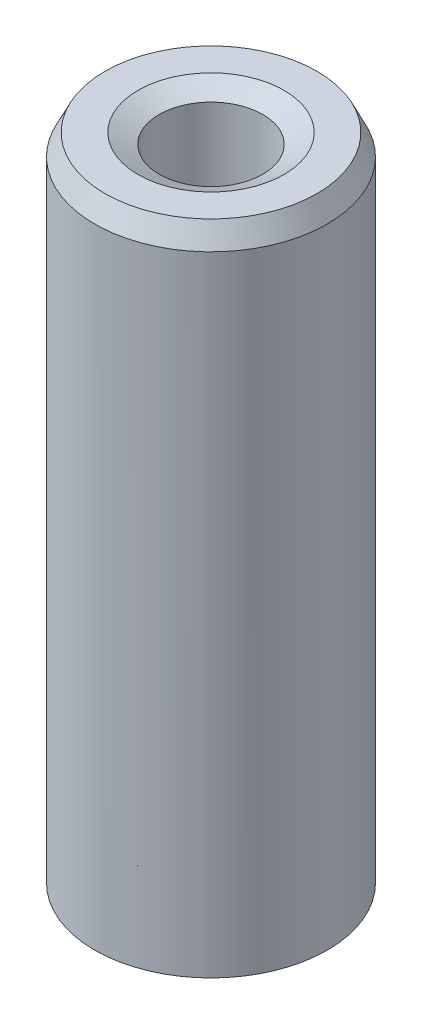
from build123d import *
from OCP.BRepFilletAPI import BRepFilletAPI_MakeChamfer

# Parameters (mm, degrees)
SKETCH1_R           = 5
BOSS_EXTRUDE1_DEPTH = 28.382326129
SKETCH2_R           = 2.226436313
CUT_EXTRUDE1_DEPTH  = 30.24989635
CHAMFER1_SIZE       = 0.910586834
CHAMFER1_SIZE2      = 0.444401364


with BuildPart() as part:
    # Sketch1 → Boss-Extrude1 (new body)
    with BuildSketch(Plane(origin=(0, 0, 0), x_dir=(1, 0, 0), z_dir=(0, 1, 0))):
        Circle(SKETCH1_R)
    extrude(amount=BOSS_EXTRUDE1_DEPTH)

    # Sketch2 → Cut-Extrude1 (cut, through all)
    with BuildSketch(Plane(origin=(0, 0, 0), x_dir=(1, 0, 0), z_dir=(0, 1, 0))):
        Circle(SKETCH2_R)
    extrude(amount=CUT_EXTRUDE1_DEPTH, mode=Mode.SUBTRACT)

    # Chamfer1: one chamfer whose edges measure the first distance from different faces: ONE call of the kernel's chamfer builder (chamfer() names one face for all edges)
    chamfer1_edges_1 = [part.edges().sort_by_distance(p)[0] for p in [
        (-2.226436313, 28.382326129, 0),
    ]]
    chamfer1_side_1 = [part.faces().sort_by_distance(p)[0] for p in [
        (-4.858578644, 28.382326129, 0),
    ]]
    chamfer1_edges_2 = [part.edges().sort_by_distance(p)[0] for p in [
        (-2.226436313, 0, 0),
    ]]
    chamfer1_side_2 = [part.faces().sort_by_distance(p)[0] for p in [
        (-2.226436313, 14.191163065, 0),
    ]]
    chamfer1_edges_3 = [part.edges().sort_by_distance(p)[0] for p in [
        (-5, 0, 0),
    ]]
    chamfer1_side_3 = [part.faces().sort_by_distance(p)[0] for p in [
        (-4.858578644, 0, 0),
    ]]
    chamfer1_edges_4 = [part.edges().sort_by_distance(p)[0] for p in [
        (-5, 28.382326129, 0),
    ]]
    chamfer1_side_4 = [part.faces().sort_by_distance(p)[0] for p in [
        (-5, 14.191163065, 0),
    ]]
    chamfer1 = BRepFilletAPI_MakeChamfer(part.part.solid().wrapped)
    for e in chamfer1_edges_1:
        chamfer1.Add(CHAMFER1_SIZE, CHAMFER1_SIZE2, e.wrapped, chamfer1_side_1[0].wrapped)  # the first distance lies on this face
    for e in chamfer1_edges_2:
        chamfer1.Add(CHAMFER1_SIZE, CHAMFER1_SIZE2, e.wrapped, chamfer1_side_2[0].wrapped)  # the first distance lies on this face
    for e in chamfer1_edges_3:
        chamfer1.Add(CHAMFER1_SIZE, CHAMFER1_SIZE2, e.wrapped, chamfer1_side_3[0].wrapped)  # the first distance lies on this face
    for e in chamfer1_edges_4:
        chamfer1.Add(CHAMFER1_SIZE, CHAMFER1_SIZE2, e.wrapped, chamfer1_side_4[0].wrapped)  # the first distance lies on this face
    add(Compound.cast(chamfer1.Shape()), mode=Mode.REPLACE)


solid = part.part
